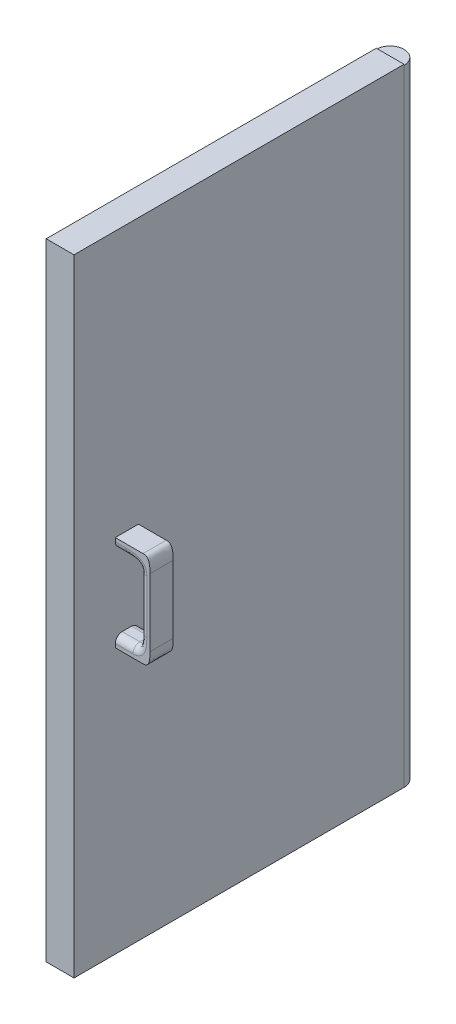
from build123d import *

# Parameters (mm, degrees)
SKIZZE1_R                       = 20
AUFSATZ_LINEAR_AUSTRAGEN1_DEPTH = 900
SKIZZE2_W                       = 40
SKIZZE2_H                       = 901.362496325
AUFSATZ_LINEAR_AUSTRAGEN2_DEPTH = 475
SKIZZE3_W                       = 33.348438909
SKIZZE3_H                       = 137.392471587
AUFSATZ_LINEAR_AUSTRAGEN3_DEPTH = 50
SKIZZE5_W                       = 35.422601633
SKIZZE5_H                       = 106.929008179
SCHNITT_LINEAR_AUSTRAGEN1_DEPTH = 33.348438909
VERRUNDUNG1_START               = 381
VERRUNDUNG1_DEPTH               = 36
VERRUNDUNG1_START_2             = 382.302757525
VERRUNDUNG1_2_DEPTH             = 33.348438909
VERRUNDUNG2_R                   = 10


with BuildPart() as part:
    # Skizze1 → Aufsatz-Linear austragen1 (new body)
    with BuildSketch(Plane(origin=(0, 0, 0), x_dir=(1, 0, 0), z_dir=(0, 1, 0))):
        with Locations(Location((0, 0, 0), (0, 0, 270))):
            Circle(SKIZZE1_R)
    extrude(amount=AUFSATZ_LINEAR_AUSTRAGEN1_DEPTH)

    # Skizze2 → Aufsatz-Linear austragen2 (add)
    with BuildSketch(Plane.XY):
        with Locations((0, 450.681248163)):
            Rectangle(SKIZZE2_W, SKIZZE2_H)
    extrude(amount=AUFSATZ_LINEAR_AUSTRAGEN2_DEPTH)

    # Skizze3 → Aufsatz-Linear austragen3 (add)
    with BuildSketch(Plane(origin=(20, 0, 0), x_dir=(0, 0, -1), z_dir=(1, 0, 0))):
        with Locations((-398.97697698, 450.590874635)):
            Rectangle(SKIZZE3_W, SKIZZE3_H)
    extrude(amount=AUFSATZ_LINEAR_AUSTRAGEN3_DEPTH)

    # Skizze5 → Schnitt-Linear austragen1 (cut)
    with BuildSketch(Plane.XY.offset(415.651196434)):
        with Locations((37.711300816, 450.590874636)):
            Rectangle(SKIZZE5_W, SKIZZE5_H)
    extrude(amount=-SCHNITT_LINEAR_AUSTRAGEN1_DEPTH, mode=Mode.SUBTRACT)

    # Verrundung1: read off the stored shape, not the designer's step
    # Verrundung1 outline → Verrundung1 (cut)
    with BuildSketch(Plane.XY.offset(VERRUNDUNG1_START)):
        with BuildLine():
            Line((70, 519.287110429), (60, 519.287110429))
            add(Edge.make_bspline(
                [(60, 519.287110429), (61.681980515, 519.287110429), (63.363961031, 519.287110429), (67.071067812, 517.853272032), (69.283080802, 513.429246053), (70, 506.01503249), (70, 502.65107146), (70, 499.287110429)],
                knots=[0, 0, 0, 0, 0, 0, 0.5, 0.5, 1, 1, 1, 1, 1, 1], degree=5))
            Line((70, 499.287110429), (70, 519.287110429))
        make_face()
        with BuildLine():
            Line((34, 519.287110429), (60, 519.287110429))
            Line((60, 519.287110429), (70, 519.287110429))
            Line((70, 519.287110429), (70, 499.287110429))
            Line((70, 499.287110429), (70, 401.894638842))
            add(Edge.make_bspline(
                [(60, 381.894638842), (61.681980515, 381.894638842), (63.363961031, 381.894638842), (67.071067812, 383.328477239), (69.283080802, 387.752503219), (70, 395.166716781), (70, 398.530677812), (70, 401.894638842)],
                knots=[0, 0, 0, 0, 0, 0, 0.5, 0.5, 1, 1, 1, 1, 1, 1], degree=5))
            Line((60, 381.894638842), (34, 381.894638842))
            Line((34, 381.894638842), (34, 380))
            Line((34, 380), (72, 380))
            Line((72, 380), (72, 521))
            Line((72, 521), (34, 521))
            Line((34, 521), (34, 519.287110429))
        make_face()
    extrude(amount=VERRUNDUNG1_DEPTH, mode=Mode.SUBTRACT)

    # Verrundung1 2 outline → Verrundung1 2 (add)
    with BuildSketch(Plane.XY.offset(VERRUNDUNG1_START_2)):
        with BuildLine():
            add(Edge.make_bspline(
                [(60, 519.287110429), (61.681980515, 519.287110429), (63.363961031, 519.287110429), (67.071067812, 517.853272032), (69.283080802, 513.429246053), (70, 506.01503249), (70, 502.65107146), (70, 499.287110429)],
                knots=[0, 0, 0, 0, 0, 0, 0.5, 0.5, 1, 1, 1, 1, 1, 1], degree=5))
            Line((60, 519.287110429), (34, 519.287110429))
            Line((34, 519.287110429), (34, 504.055378725))
            Line((34, 504.055378725), (35.422601633, 504.055378725))
            add(Edge.make_bspline(
                [(55.422601633, 494.055378725), (55.422601633, 495.737359241), (55.422601633, 497.419339756), (53.988763236, 501.126446537), (49.564737256, 503.338459527), (42.150523694, 504.055378725), (38.786562663, 504.055378725), (35.422601633, 504.055378725)],
                knots=[0, 0, 0, 0, 0, 0, 0.5, 0.5, 1, 1, 1, 1, 1, 1], degree=5))
            Line((55.422601633, 494.055378725), (55.422601633, 417.126370546))
            add(Edge.make_bspline(
                [(55.422601633, 417.126370546), (55.422601633, 413.762409515), (55.422601633, 410.398448485), (54.705682434, 402.984234922), (52.493669444, 398.560208943), (48.786562663, 397.126370546), (47.104582148, 397.126370546), (45.422601633, 397.126370546)],
                knots=[0, 0, 0, 0, 0, 0, 0.5, 0.5, 1, 1, 1, 1, 1, 1], degree=5))
            Line((45.422601633, 397.126370546), (34, 397.126370546))
            Line((34, 397.126370546), (34, 381.894638842))
            Line((34, 381.894638842), (60, 381.894638842))
            add(Edge.make_bspline(
                [(60, 381.894638842), (61.681980515, 381.894638842), (63.363961031, 381.894638842), (67.071067812, 383.328477239), (69.283080802, 387.752503219), (70, 395.166716781), (70, 398.530677812), (70, 401.894638842)],
                knots=[0, 0, 0, 0, 0, 0, 0.5, 0.5, 1, 1, 1, 1, 1, 1], degree=5))
            Line((70, 401.894638842), (70, 499.287110429))
        make_face()
    extrude(amount=VERRUNDUNG1_2_DEPTH)

    # Verrundung2
    verrundung2_edges = [part.edges().sort_by_distance(p)[0] for p in [
        (27, 397.126370546, 382.302757525),
        (27, 504.055378725, 382.302757525),
        (27, 397.126370546, 415.651196434),
        (27, 504.055378725, 415.651196434),
        (48.065631197, 502.943403706, 382.302757525),
        (55.422601633, 455.590874635, 382.302757525),
        (54.310843649, 404.484157941, 382.302757525),
        (48.065631197, 502.943403706, 415.651196434),
        (54.310843649, 404.484157941, 415.651196434),
        (55.422601633, 455.590874635, 415.651196434),
    ]]
    fillet(verrundung2_edges, radius=VERRUNDUNG2_R)


solid = part.part
